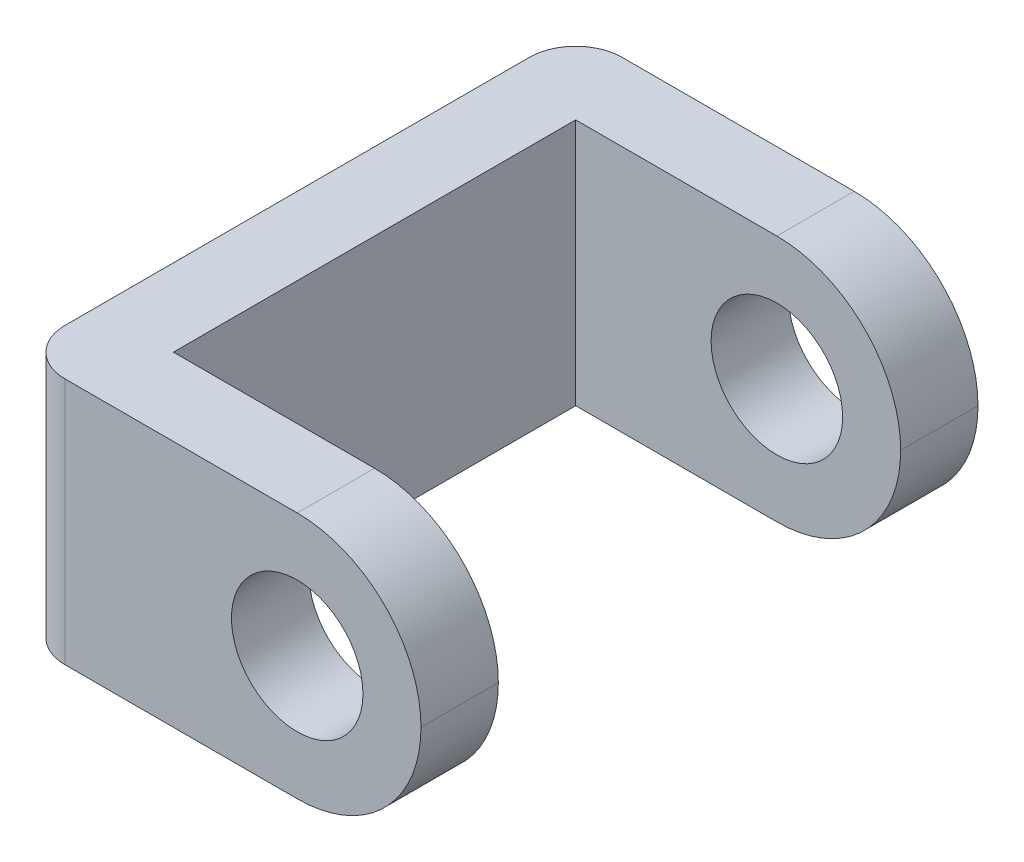
from build123d import *

# Parameters (mm, degrees)
EXTRUDE_1_DEPTH     = 16
FILLET_1_R          = 8
FILLET_2_R          = 3
SKETCH_2_R          = 4.25
CUT_EXTRUDE_1_DEPTH = 48.201694885


with BuildPart() as part:
    # Эскиз1 → Бобышка-Вытянуть1 (new body)
    with BuildSketch(Plane(origin=(0, 0, 0), x_dir=(1, 0, 0), z_dir=(0, 1, 0))):
        Polygon((0, 18), (0, -18), (26, -18), (26, -13), (5, -13), (5, 13), (26, 13), (26, 18), align=None)
    extrude(amount=EXTRUDE_1_DEPTH)

    # Скругление1
    fillet_1_edges = [part.edges().sort_by_distance(p)[0] for p in [
        (26, 0, -15.5),
        (26, 16, -15.5),
        (26, 0, 15.5),
        (26, 16, 15.5),
    ]]
    fillet(fillet_1_edges, radius=FILLET_1_R - 0.0001)  # a hair under: the kernel refuses the full size

    # Скругление2
    fillet_2_edges = [part.edges().sort_by_distance(p)[0] for p in [
        (0, 8, 18),
        (0, 8, -18),
    ]]
    fillet(fillet_2_edges, radius=FILLET_2_R)

    # Эскиз2 → Вырез-Вытянуть1 (cut, through all)
    with BuildSketch(Plane.XY.offset(18)):
        with Locations((18, 8)):
            Circle(SKETCH_2_R)
    extrude(amount=-CUT_EXTRUDE_1_DEPTH, mode=Mode.SUBTRACT)


solid = part.part
